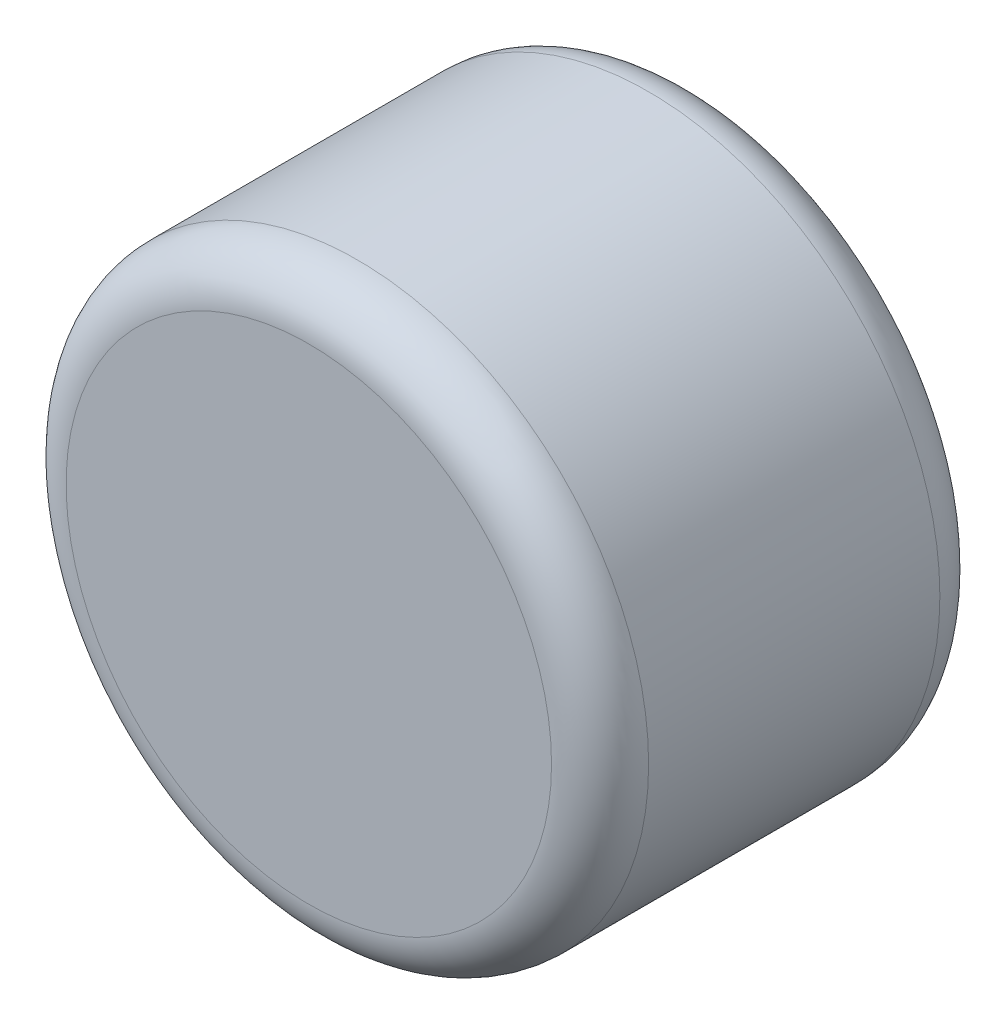
from build123d import *

# Parameters (mm, degrees)
SCHIZZO1_R                   = 3
ESTRUSIONE_ESTRUSIONE1_DEPTH = 4
RACCORDO1_R                  = 0.5


with BuildPart() as part:
    # Schizzo1 → Estrusione-Estrusione1 (new body)
    with BuildSketch(Plane.XY):
        Circle(SCHIZZO1_R)
    extrude(amount=ESTRUSIONE_ESTRUSIONE1_DEPTH)

    # Raccordo1
    raccordo1_edges = [part.edges().sort_by_distance(p)[0] for p in [
        (-3, 0, 0),
        (-3, 0, 4),
    ]]
    fillet(raccordo1_edges, radius=RACCORDO1_R)


solid = part.part
